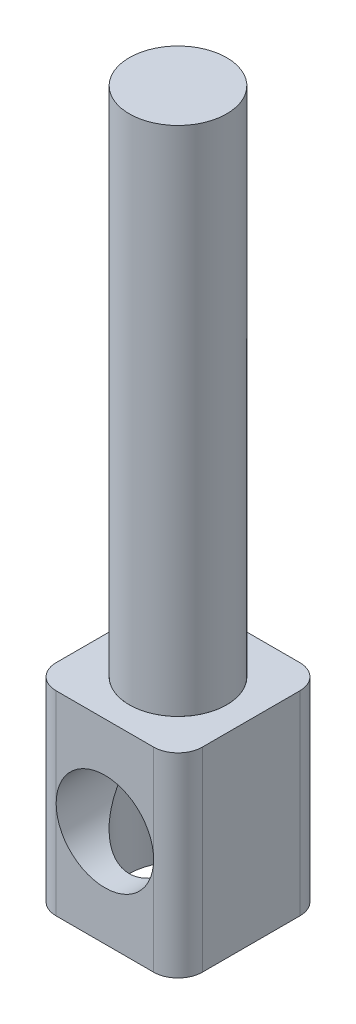
from build123d import *

# Parameters (mm, degrees)
SKETCH1_W           = 6
SKETCH1_H           = 6
SKETCH1_R           = 2
BOSS_EXTRUDE1_DEPTH = 8
SKETCH2_R           = 1.99840551
BOSS_EXTRUDE2_DEPTH = 21
SKETCH3_R           = 2
CUT_EXTRUDE1_DEPTH  = 3
FILLET1_R           = 1


with BuildPart() as part:
    # Sketch1 → Boss-Extrude1 (new body)
    with BuildSketch(Plane(origin=(0, 0, 0), x_dir=(1, 0, 0), z_dir=(0, 1, 0))):
        Rectangle(SKETCH1_W, SKETCH1_H)
        with Locations(Location((0, 0, 0), (0, 0, 270))):
            Circle(SKETCH1_R, mode=Mode.SUBTRACT)
    extrude(amount=BOSS_EXTRUDE1_DEPTH)

    # Sketch3 → Cut-Extrude1 (cut)
    with BuildSketch(Plane.XY.offset(3)):
        with Locations((0, 4)):
            Circle(SKETCH3_R)
    extrude(amount=-CUT_EXTRUDE1_DEPTH, mode=Mode.SUBTRACT)

    # Fillet1
    fillet1_edges = [part.edges().sort_by_distance(p)[0] for p in [
        (-3, 4, -3),
        (3, 4, -3),
        (3, 4, 3),
        (-3, 4, 3),
    ]]
    fillet(fillet1_edges, radius=FILLET1_R - 0.0001)  # a hair under: the kernel refuses the full size


with BuildPart() as body_2:
    # Sketch2 → Boss-Extrude2 (new body)
    with BuildSketch(Plane(origin=(0, 8, 0), x_dir=(1, 0, 0), z_dir=(0, 1, 0))):
        with Locations(Location((0, 0, 0), (0, 0, 90))):
            Circle(SKETCH2_R)
    extrude(amount=BOSS_EXTRUDE2_DEPTH)


solid = Compound([part.part, body_2.part])
